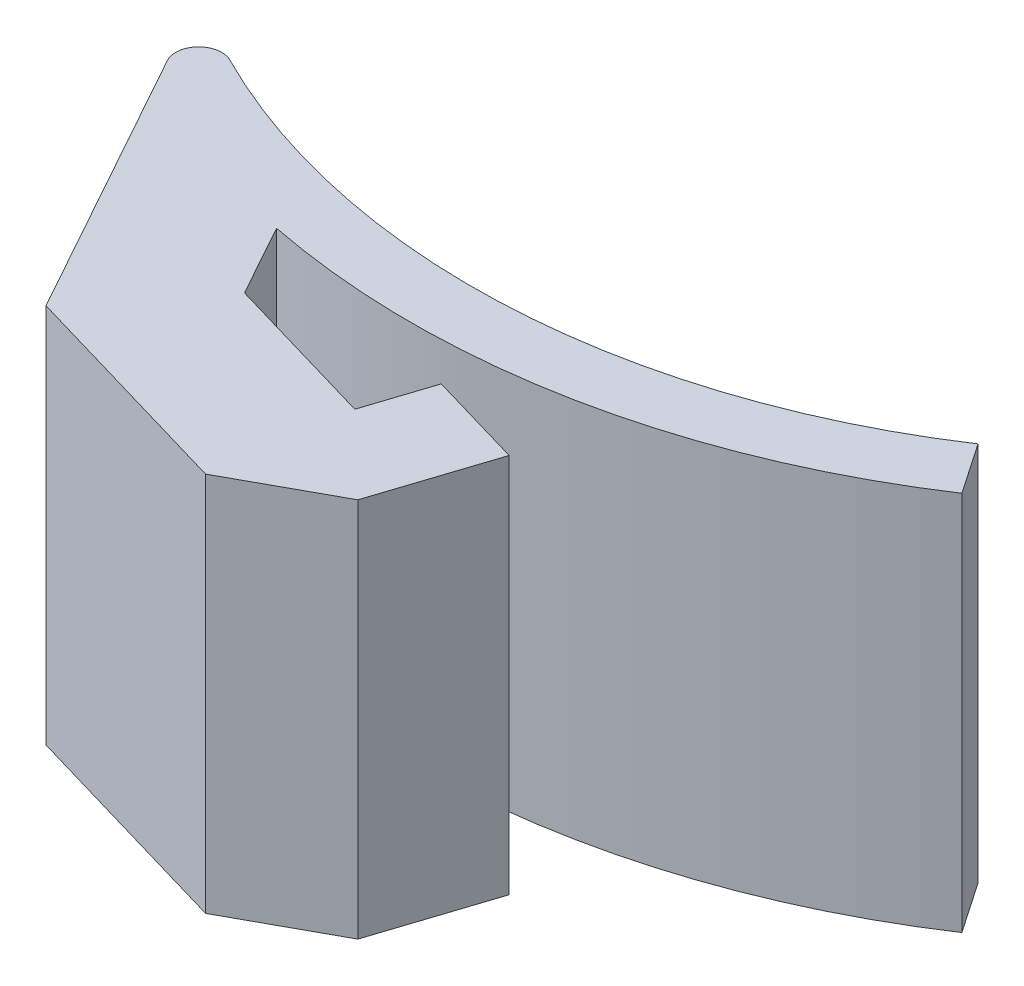
from build123d import *

# Parameters (mm, degrees)
EXTRUDE_1_DEPTH = 4.95
CHAMFER_1_SIZE  = 1
CHAMFER_1_SIZE2 = 1.032395136


with BuildPart() as part:
    # Эскиз1 → Бобышка-Вытянуть1 (new body)
    with BuildSketch(Plane(origin=(0, 0, 0), x_dir=(1, 0, 0), z_dir=(0, 1, 0))):
        with BuildLine():
            Line((2.5, -4.5), (6.395063253, -5.64))
            Line((6.395063253, -5.64), (7.2, -3.175018115))
            Line((7.2, -3.175018115), (5.952339772, -2.809855198))
            Line((5.952339772, -2.809855198), (5.675364666, -3.658044352))
            Line((5.675364666, -3.658044352), (3.647199382, -3.06444464))
            Line((3.647199382, -3.06444464), (3.126833621, -2.12778627))
            ThreePointArc((3.126833621, -2.12778627), (6.994242164, -2.125926125), (10.57111662, -0.655272725))
            Line((10.57111662, -0.655272725), (10.119998501, 0.005508219))
            ThreePointArc((10.119998501, 0.005508219), (5.594481852, -1.5), (0.923871938, -0.534464416))
            ThreePointArc((0.923871938, -0.534464416), (0.572572084, -0.594660683), (0.526733755, -0.948120759))
            Line((0.526733755, -0.948120759), (2.5, -4.5))
        make_face()
    extrude(amount=EXTRUDE_1_DEPTH)

    # Фаска1
    chamfer_1_edges = [part.edges().sort_by_distance(p)[0] for p in [
        (6.395063253, 2.475, 5.64),
    ]]
    chamfer_1_side = [part.faces().sort_by_distance(p)[0] for p in [
        (4.447531626, 2.475, 5.07),
    ]]
    chamfer(chamfer_1_edges, length=CHAMFER_1_SIZE, length2=CHAMFER_1_SIZE2, reference=chamfer_1_side[0])


solid = part.part
